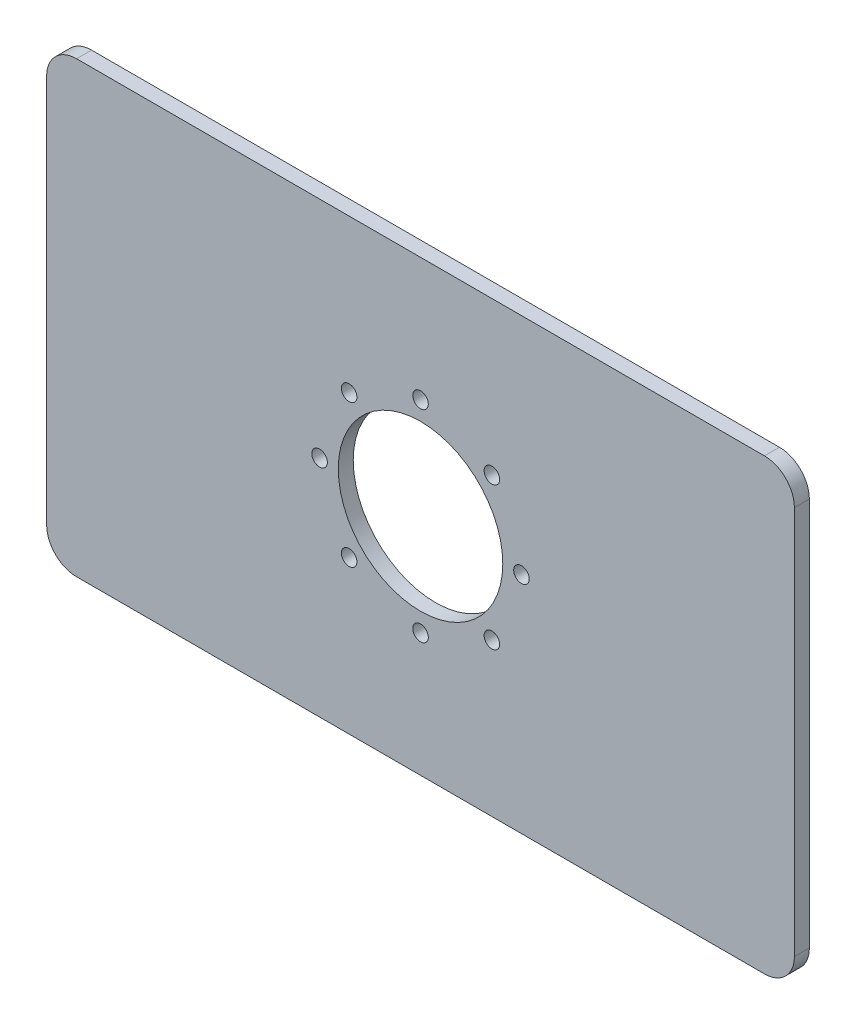
from build123d import *

# Parameters (mm, degrees)
SKETCH_1_W          = 250
SKETCH_1_H          = 150
EXTRUDE_1_DEPTH     = 5
CUT_EXTRUDE_2_REACH = 147.86
SKETCH_5_R          = 27.5
SKETCH_5_R_2        = 2.6
FILLET_1_R          = 10


with BuildPart() as part:
    # 草图1 → 凸台-拉伸1 (new body)
    with BuildSketch(Plane.XY):
        Rectangle(SKETCH_1_W, SKETCH_1_H)
    extrude(amount=EXTRUDE_1_DEPTH)

    # 草图5 → 切除-拉伸2 (cut, up to next)
    with BuildSketch(Plane(origin=(0, 0, 0), x_dir=(-1, 0, 0), z_dir=(0, 0, -1)), mode=Mode.PRIVATE) as cut_extrude_2_sk1:
        Circle(SKETCH_5_R)
    cut_extrude_2_tool1 = extrude(cut_extrude_2_sk1.sketch, amount=-CUT_EXTRUDE_2_REACH, mode=Mode.PRIVATE) & part.part
    # 草图5 → 切除-拉伸2 (cut, up to next)
    with BuildSketch(Plane(origin=(0, 0, 0), x_dir=(-1, 0, 0), z_dir=(0, 0, -1)), mode=Mode.PRIVATE) as cut_extrude_2_sk2:
        with Locations((23.864853865, 23.864853865)):
            Circle(SKETCH_5_R_2)
    cut_extrude_2_tool2 = extrude(cut_extrude_2_sk2.sketch, amount=-CUT_EXTRUDE_2_REACH, mode=Mode.PRIVATE) & part.part
    # 草图5 → 切除-拉伸2 (cut, up to next)
    with BuildSketch(Plane(origin=(0, 0, 0), x_dir=(-1, 0, 0), z_dir=(0, 0, -1)), mode=Mode.PRIVATE) as cut_extrude_2_sk3:
        with Locations((0, 33.75)):
            Circle(SKETCH_5_R_2)
    cut_extrude_2_tool3 = extrude(cut_extrude_2_sk3.sketch, amount=-CUT_EXTRUDE_2_REACH, mode=Mode.PRIVATE) & part.part
    # 草图5 → 切除-拉伸2 (cut, up to next)
    with BuildSketch(Plane(origin=(0, 0, 0), x_dir=(-1, 0, 0), z_dir=(0, 0, -1)), mode=Mode.PRIVATE) as cut_extrude_2_sk4:
        with Locations((-23.864853865, 23.864853865)):
            Circle(SKETCH_5_R_2)
    cut_extrude_2_tool4 = extrude(cut_extrude_2_sk4.sketch, amount=-CUT_EXTRUDE_2_REACH, mode=Mode.PRIVATE) & part.part
    # 草图5 → 切除-拉伸2 (cut, up to next)
    with BuildSketch(Plane(origin=(0, 0, 0), x_dir=(-1, 0, 0), z_dir=(0, 0, -1)), mode=Mode.PRIVATE) as cut_extrude_2_sk5:
        with Locations((-33.75, 0)):
            Circle(SKETCH_5_R_2)
    cut_extrude_2_tool5 = extrude(cut_extrude_2_sk5.sketch, amount=-CUT_EXTRUDE_2_REACH, mode=Mode.PRIVATE) & part.part
    # 草图5 → 切除-拉伸2 (cut, up to next)
    with BuildSketch(Plane(origin=(0, 0, 0), x_dir=(-1, 0, 0), z_dir=(0, 0, -1)), mode=Mode.PRIVATE) as cut_extrude_2_sk6:
        with Locations((-23.864853865, -23.864853865)):
            Circle(SKETCH_5_R_2)
    cut_extrude_2_tool6 = extrude(cut_extrude_2_sk6.sketch, amount=-CUT_EXTRUDE_2_REACH, mode=Mode.PRIVATE) & part.part
    # 草图5 → 切除-拉伸2 (cut, up to next)
    with BuildSketch(Plane(origin=(0, 0, 0), x_dir=(-1, 0, 0), z_dir=(0, 0, -1)), mode=Mode.PRIVATE) as cut_extrude_2_sk7:
        with Locations((0, -33.75)):
            Circle(SKETCH_5_R_2)
    cut_extrude_2_tool7 = extrude(cut_extrude_2_sk7.sketch, amount=-CUT_EXTRUDE_2_REACH, mode=Mode.PRIVATE) & part.part
    # 草图5 → 切除-拉伸2 (cut, up to next)
    with BuildSketch(Plane(origin=(0, 0, 0), x_dir=(-1, 0, 0), z_dir=(0, 0, -1)), mode=Mode.PRIVATE) as cut_extrude_2_sk8:
        with Locations((23.864853865, -23.864853865)):
            Circle(SKETCH_5_R_2)
    cut_extrude_2_tool8 = extrude(cut_extrude_2_sk8.sketch, amount=-CUT_EXTRUDE_2_REACH, mode=Mode.PRIVATE) & part.part
    # 草图5 → 切除-拉伸2 (cut, up to next)
    with BuildSketch(Plane(origin=(0, 0, 0), x_dir=(-1, 0, 0), z_dir=(0, 0, -1)), mode=Mode.PRIVATE) as cut_extrude_2_sk9:
        with Locations((33.75, 0)):
            Circle(SKETCH_5_R_2)
    cut_extrude_2_tool9 = extrude(cut_extrude_2_sk9.sketch, amount=-CUT_EXTRUDE_2_REACH, mode=Mode.PRIVATE) & part.part
    add(cut_extrude_2_tool1.solids().sort_by_distance((0, 0, 0))[0], mode=Mode.SUBTRACT)
    add(cut_extrude_2_tool2.solids().sort_by_distance((-23.864854, 23.864854, 0))[0], mode=Mode.SUBTRACT)
    add(cut_extrude_2_tool3.solids().sort_by_distance((0, 33.75, 0))[0], mode=Mode.SUBTRACT)
    add(cut_extrude_2_tool4.solids().sort_by_distance((23.864854, 23.864854, 0))[0], mode=Mode.SUBTRACT)
    add(cut_extrude_2_tool5.solids().sort_by_distance((33.75, 0, 0))[0], mode=Mode.SUBTRACT)
    add(cut_extrude_2_tool6.solids().sort_by_distance((23.864854, -23.864854, 0))[0], mode=Mode.SUBTRACT)
    add(cut_extrude_2_tool7.solids().sort_by_distance((0, -33.75, 0))[0], mode=Mode.SUBTRACT)
    add(cut_extrude_2_tool8.solids().sort_by_distance((-23.864854, -23.864854, 0))[0], mode=Mode.SUBTRACT)
    add(cut_extrude_2_tool9.solids().sort_by_distance((-33.75, 0, 0))[0], mode=Mode.SUBTRACT)

    # 圆角1
    fillet_1_edges = [part.edges().sort_by_distance(p)[0] for p in [
        (125, 75, 2.5),
        (125, -75, 2.5),
        (-125, -75, 2.5),
        (-125, 75, 2.5),
    ]]
    fillet(fillet_1_edges, radius=FILLET_1_R)


solid = part.part
